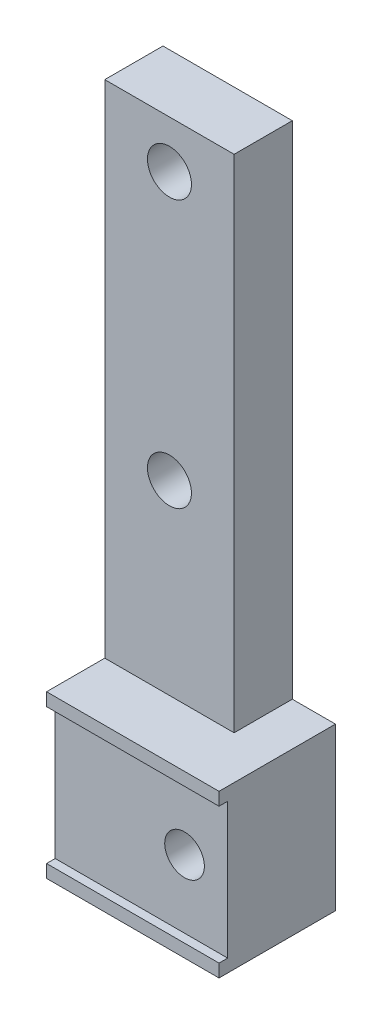
from build123d import *

# Parameters (mm, degrees)
PROFILESKETCH3_R               = 2.55
PROFILESKETCH3_R_2             = 2.3
PROFILEBOSS_EXTRUDE1_DEPTH     = 13.5
SKETCH1_W                      = 20
SKETCH1_H                      = 15.75
SLIDINGMOUNTCUT_EXTRUDE1_DEPTH = 1
SKETCH2_W                      = 15
SKETCH2_H                      = 58.1
CUT_EXTRUDE1_DEPTH             = 6.75


with BuildPart() as part:
    # ProfileSketch3 → ProfileBoss-Extrude1 (new body)
    with BuildSketch(Plane.XY):
        Polygon((0, 0), (20, 0), (20, 18.75), (15, 18.75), (15, 76.85), (0, 76.85), align=None)
        with Locations((7.5, 40.35)):
            Circle(PROFILESKETCH3_R, mode=Mode.SUBTRACT)
        with Locations((7.5, 71.35)):
            Circle(PROFILESKETCH3_R, mode=Mode.SUBTRACT)
        with Locations((15, 9.375)):
            Circle(PROFILESKETCH3_R_2, mode=Mode.SUBTRACT)
    extrude(amount=PROFILEBOSS_EXTRUDE1_DEPTH)

    # Sketch1 → SlidingMountCut-Extrude1 (cut)
    with BuildSketch(Plane.XY.offset(13.5)):
        with Locations((10, 9.375)):
            Rectangle(SKETCH1_W, SKETCH1_H)
    extrude(amount=-SLIDINGMOUNTCUT_EXTRUDE1_DEPTH, mode=Mode.SUBTRACT)

    # Sketch2 → Cut-Extrude1 (cut)
    with BuildSketch(Plane.XY.offset(13.5)):
        with Locations((7.5, 47.8)):
            Rectangle(SKETCH2_W, SKETCH2_H)
    extrude(amount=-CUT_EXTRUDE1_DEPTH, mode=Mode.SUBTRACT)


solid = part.part
